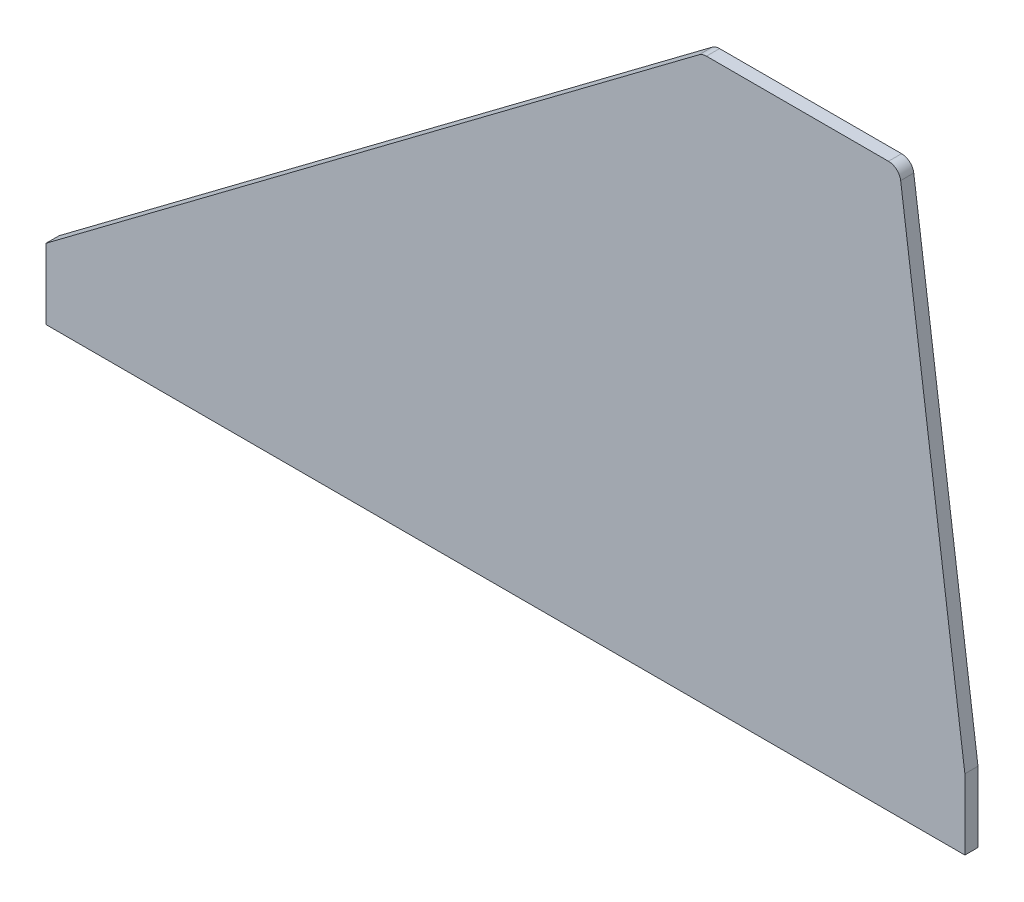
from build123d import *

# Parameters (mm, degrees)
FIN_BODY_DEPTH = 5.08
FIN_FILLETS_R  = 4.7625


with BuildPart() as part:
    # Fin Profile → Fin Body (new body)
    with BuildSketch(Plane.XY):
        Polygon((355.6, -27.2542), (0, -27.2542), (0, 0), (254, 190.5), (330.2, 190.5), (355.6, 0), align=None)
    extrude(amount=FIN_BODY_DEPTH)

    # Fin Fillets
    fin_fillets_edges = [part.edges().sort_by_distance(p)[0] for p in [
        (330.2, 190.5, 2.54),
        (254, 190.5, 2.54),
    ]]
    fillet(fin_fillets_edges, radius=FIN_FILLETS_R)


solid = part.part
